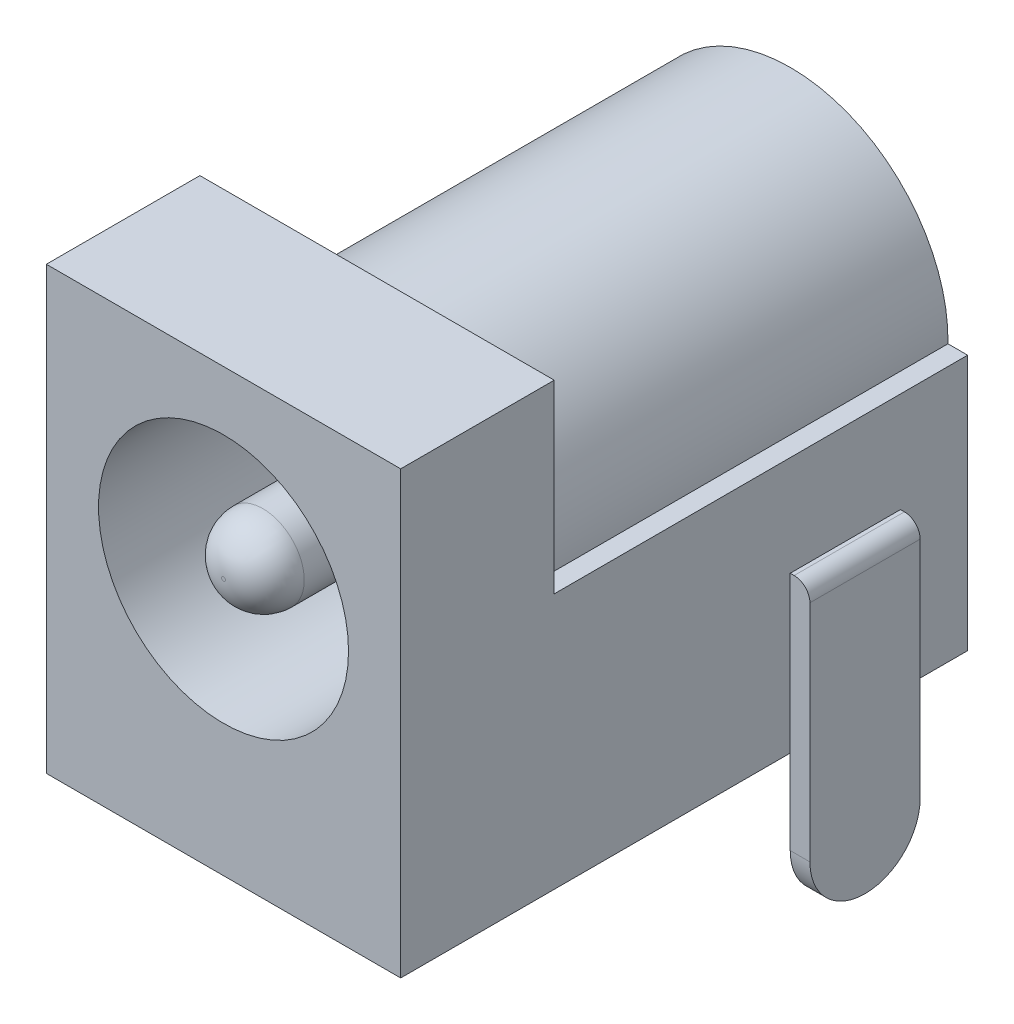
from build123d import *

# Parameters (mm, degrees)
SCHIZZO1_W                        = 9
SCHIZZO1_H                        = 14.4
ESTRUSIONE_ESTRUSIONE1_DEPTH      = 11.2
SCHIZZO2_R                        = 3.175
TAGLIO_ESTRUSIONE1_DEPTH          = 10
SCHIZZO3_R                        = 1.05
ESTRUSIONE_ESTRUSIONE2_DEPTH      = 10
RACCORDO1_R                       = 1
TAGLIO_ESTRUSIONE2_DEPTH          = 10.5
ESTRUSIONE_ESTRUSIONE3_DEPTH      = 3.5
ESTRUSIONE_ESTRUSIONE3_DEPTH_BACK = 4
SCHIZZO5_W                        = 2.8
SCHIZZO5_H                        = 0.5
SCHIZZO5_W_2                      = 0.5
SCHIZZO5_H_2                      = 2.8
RACCORDO2_R                       = 0.4
RACCORDO3_R                       = 1.4
RACCORDO4_R                       = 1.4
RACCORDO5_R                       = 1.4


with BuildPart() as part:
    # Schizzo1 → Estrusione-Estrusione1 (new body)
    with BuildSketch(Plane(origin=(0, 0, 0), x_dir=(1, 0, 0), z_dir=(0, 1, 0))):
        with Locations((4.5, 7.2)):
            Rectangle(SCHIZZO1_W, SCHIZZO1_H)
    extrude(amount=ESTRUSIONE_ESTRUSIONE1_DEPTH)

    # Schizzo2 → Taglio-Estrusione1 (cut)
    with BuildSketch(Plane.XY):
        with Locations((4.5, 6.525)):
            Circle(SCHIZZO2_R)
    extrude(amount=-TAGLIO_ESTRUSIONE1_DEPTH, mode=Mode.SUBTRACT)

    # Schizzo3 → Estrusione-Estrusione2 (add)
    with BuildSketch(Plane.XY.offset(-10)):
        with Locations((4.5, 6.525)):
            Circle(SCHIZZO3_R)
    extrude(amount=ESTRUSIONE_ESTRUSIONE2_DEPTH)

    # Raccordo1
    raccordo1_edges = [part.edges().sort_by_distance(p)[0] for p in [
        (3.45, 6.525, 0),
    ]]
    fillet(raccordo1_edges, radius=RACCORDO1_R)

    # Schizzo4 → Taglio-Estrusione2 (cut)
    with BuildSketch(Plane(origin=(0, 0, -14.4), x_dir=(-1, 0, 0), z_dir=(0, 0, -1))):
        with BuildLine():
            Line((-9, 6.5), (-9, 11.2))
            Line((-9, 11.2), (0, 11.2))
            Line((0, 11.2), (0, 6.5))
            Line((0, 6.5), (-0.5, 6.5))
            ThreePointArc((-0.5, 6.5), (-4.5, 10.578198038), (-8.5, 6.5))
            Line((-8.5, 6.5), (-9, 6.5))
        make_face()
    extrude(amount=-TAGLIO_ESTRUSIONE2_DEPTH, mode=Mode.SUBTRACT)

    # Schizzo5 → Estrusione-Estrusione3 (add, two sides: drawn at the far end of the back side and taken through both)
    with BuildSketch(Plane(origin=(0, 0, 0), x_dir=(-1, 0, 0), z_dir=(0, -1, 0)).offset(-ESTRUSIONE_ESTRUSIONE3_DEPTH_BACK)):
        with Locations((-4.5, 8.75)):
            Rectangle(SCHIZZO5_W, SCHIZZO5_H)
        with Locations((-4.5, 13.75)):
            Rectangle(SCHIZZO5_W, SCHIZZO5_H)
        with Locations((-9.293549244, 11.25)):
            Rectangle(SCHIZZO5_W_2, SCHIZZO5_H_2)
    extrude(amount=ESTRUSIONE_ESTRUSIONE3_DEPTH + ESTRUSIONE_ESTRUSIONE3_DEPTH_BACK)


with BuildPart() as estrusione_estrusione3_piece_1:
    # of the separate pieces the step leaves, piece 1, a body of its own (estrusione_estrusione3_pieces)
    add(part.part.solids().sort_by_distance((5.55, 6.525, -1))[0])

    # Raccordo4
    raccordo4_edges = [estrusione_estrusione3_piece_1.edges().sort_by_distance(p)[0] for p in [
        (3.1, -3.5, -13.75),
        (5.9, -3.5, -13.75),
    ]]
    fillet(raccordo4_edges, radius=RACCORDO4_R - 0.0001)  # a hair under: the kernel refuses the full size

    # Raccordo5
    raccordo5_edges = [estrusione_estrusione3_piece_1.edges().sort_by_distance(p)[0] for p in [
        (3.1, -3.5, -8.75),
        (5.9, -3.5, -8.75),
    ]]
    fillet(raccordo5_edges, radius=RACCORDO5_R - 0.0001)  # a hair under: the kernel refuses the full size


with BuildPart() as estrusione_estrusione3_piece_2:
    # of the separate pieces the step leaves, piece 2, a body of its own (estrusione_estrusione3_pieces)
    add(part.part.solids().sort_by_distance((9.043549244, -3.5, -9.85))[0])

    # Raccordo2
    raccordo2_edges = [estrusione_estrusione3_piece_2.edges().sort_by_distance(p)[0] for p in [
        (9.543549244, 4, -11.25),
    ]]
    fillet(raccordo2_edges, radius=RACCORDO2_R)

    # Raccordo3
    raccordo3_edges = [estrusione_estrusione3_piece_2.edges().sort_by_distance(p)[0] for p in [
        (9.293549244, -3.5, -9.85),
        (9.293549244, -3.5, -12.65),
    ]]
    fillet(raccordo3_edges, radius=RACCORDO3_R - 0.0001)  # a hair under: the kernel refuses the full size


solid = Compound([estrusione_estrusione3_piece_1.part, estrusione_estrusione3_piece_2.part])
